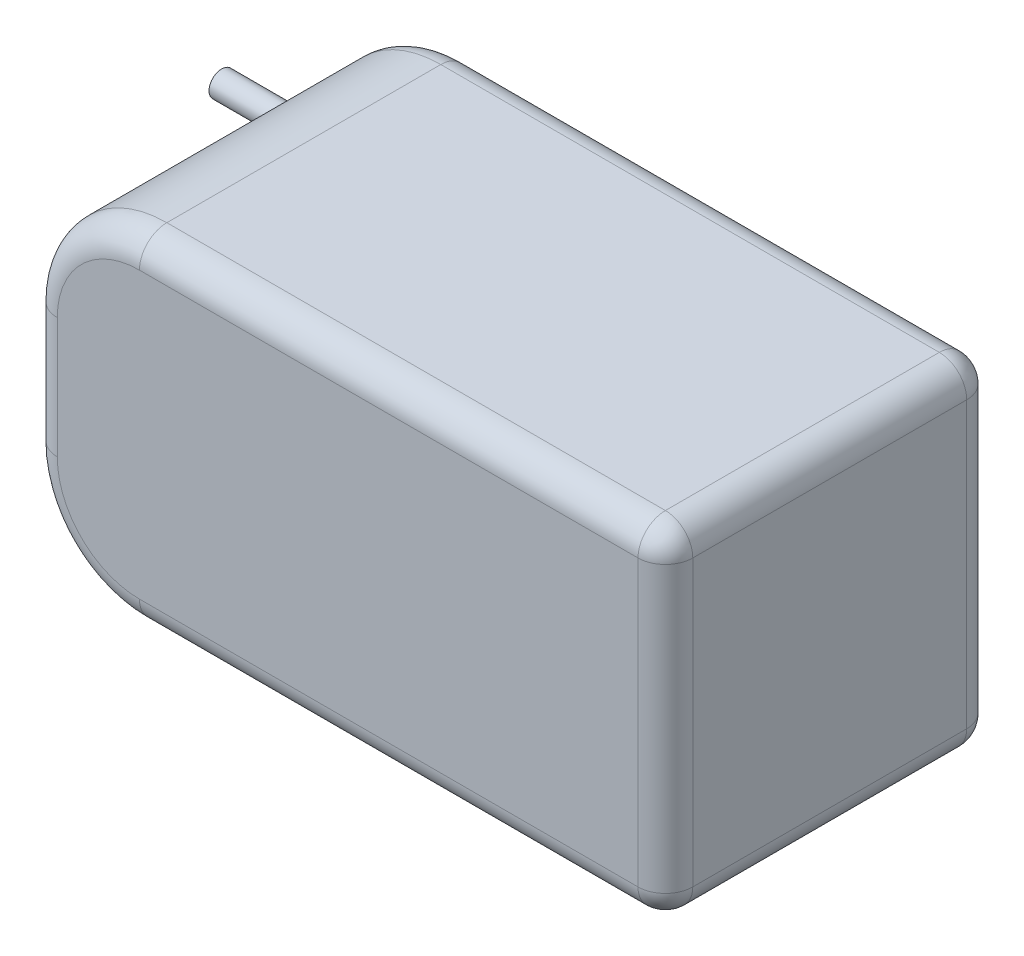
from build123d import *

# Parameters (mm, degrees)
SKETCH1_W           = 58
SKETCH1_H           = 30
BOSS_EXTRUDE1_DEPTH = 31
FILLET1_R           = 10
FILLET2_R           = 2.5
SKETCH2_R           = 1.15
BOSS_EXTRUDE2_DEPTH = 10


with BuildPart() as part:
    # Sketch1 → Boss-Extrude1 (new body)
    with BuildSketch(Plane(origin=(0, 0, 0), x_dir=(1, 0, 0), z_dir=(0, 1, 0))):
        Rectangle(SKETCH1_W, SKETCH1_H)
    extrude(amount=BOSS_EXTRUDE1_DEPTH)

    # Fillet1
    fillet1_edges = [part.edges().sort_by_distance(p)[0] for p in [
        (-29, 0, 0),
        (-29, 31, 0),
    ]]
    fillet(fillet1_edges, radius=FILLET1_R)

    # Fillet2
    fillet2_edges = [part.edges().sort_by_distance(p)[0] for p in [
        (5, 0, 15),
        (-26.071067812, 2.928932188, 15),
        (-29, 15.5, 15),
        (-26.071067812, 28.071067812, 15),
        (5, 0, -15),
        (-26.071067812, 2.928932188, -15),
        (-29, 15.5, -15),
        (-26.071067812, 28.071067812, -15),
        (29, 31, 0),
        (5, 31, 15),
        (5, 31, -15),
        (29, 15.5, 15),
        (29, 15.5, -15),
        (29, 0, 0),
    ]]
    fillet(fillet2_edges, radius=FILLET2_R)

    # Sketch2 → Boss-Extrude2 (add)
    with BuildSketch(Plane.ZY.offset(29)):
        with Locations((-12.5, 19.5)):
            Circle(SKETCH2_R)
        with Locations((-12.5, 11.5)):
            Circle(SKETCH2_R)
    extrude(amount=BOSS_EXTRUDE2_DEPTH)


solid = part.part
